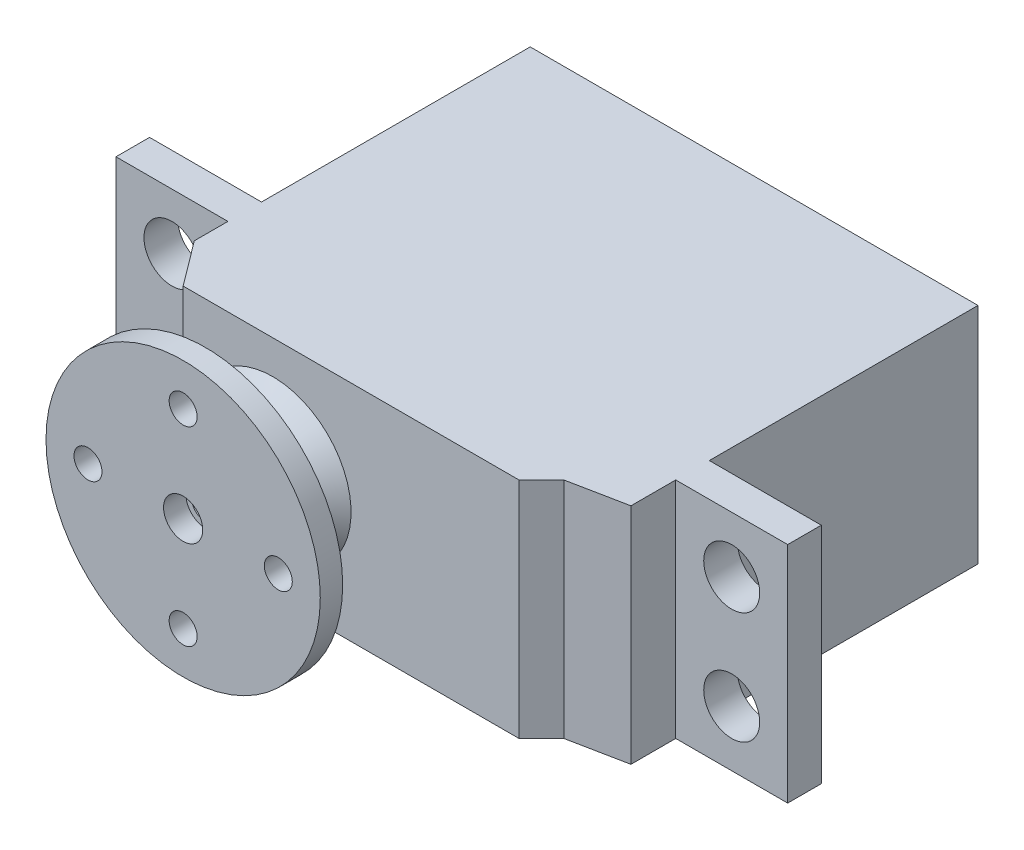
from build123d import *

# Parameters (mm, degrees)
SKETCH_1_W             = 40
SKETCH_1_H             = 20
EXTRUDE_1_DEPTH        = 37
CUT_EXTRUDE_1_DEPTH    = 47.572524089
CUT_EXTRUDE_2_DEPTH    = 47.572524089
CHAMFER_1_SIZE         = 3
SKETCH_4_R             = 7
EXTRUDE_2_DEPTH        = 2
CHAMFER_2_SIZE         = 2
SKETCH_5_R             = 3
EXTRUDE_3_DEPTH        = 4
SKETCH_6_W             = 10
SKETCH_6_H             = 20
EXTRUDE_4_DEPTH        = 3
SKETCH_7_R             = 2.5
CUT_EXTRUDE_3_DEPTH    = 3
HOLE_WIZARD_M3_1_D     = 2.5
HOLE_WIZARD_M3_1_DEPTH = 8.5
HOLE_WIZARD_M3_1_TIP   = 0.751075774
SKETCH_10_R            = 12.25
SKETCH_10_R_2          = 1.25
SKETCH_10_R_3          = 1.75
EXTRUDE_5_DEPTH        = 2


with BuildPart() as part:
    # 草图1 → 凸台-拉伸1 (new body)
    with BuildSketch(Plane.XY):
        Rectangle(SKETCH_1_W, SKETCH_1_H)
    extrude(amount=EXTRUDE_1_DEPTH)

    # 草图2 → 切除-拉伸1 (cut, through all)
    with BuildSketch(Plane.XZ.offset(10)):
        Polygon((20, 34), (15, 35), (13, 37), (20, 37), align=None)
    extrude(amount=-CUT_EXTRUDE_1_DEPTH, mode=Mode.SUBTRACT)

    # 草图3 → 切除-拉伸2 (cut, through all)
    with BuildSketch(Plane.XZ.offset(10)):
        Polygon((-20, 37), (-17, 37), (-20, 33), align=None)
    extrude(amount=-CUT_EXTRUDE_2_DEPTH, mode=Mode.SUBTRACT)

    # 倒角1
    chamfer_1_edges = [part.edges().sort_by_distance(p)[0] for p in [
        (0, -10, 0),
        (-20, 0, 0),
        (0, 10, 0),
        (20, 0, 0),
    ]]
    chamfer(chamfer_1_edges, length=CHAMFER_1_SIZE)

    # 草图4 → 凸台-拉伸2 (add)
    with BuildSketch(Plane.XY.offset(37)):
        with Locations(Location((-9, 0, 0), (0, 0, 180))):
            Circle(SKETCH_4_R)
    extrude(amount=EXTRUDE_2_DEPTH)

    # 倒角2
    chamfer_2_edges = [part.edges().sort_by_distance(p)[0] for p in [
        (-2, 0, 39),
    ]]
    chamfer(chamfer_2_edges, length=CHAMFER_2_SIZE - 0.0001)  # a hair under: the kernel refuses the full size

    # 草图5 → 凸台-拉伸3 (add)
    with BuildSketch(Plane.XY.offset(39)):
        with Locations((-9, 0)):
            Circle(SKETCH_5_R)
    extrude(amount=EXTRUDE_3_DEPTH)

    # 草图6 → 凸台-拉伸4 (add)
    with BuildSketch(Plane(origin=(0, 0, 30), x_dir=(-1, 0, 0), z_dir=(0, 0, -1))):
        with Locations((25, 0)):
            Rectangle(SKETCH_6_W, SKETCH_6_H)
        with Locations((-25, 0)):
            Rectangle(SKETCH_6_W, SKETCH_6_H)
    extrude(amount=EXTRUDE_4_DEPTH)

    # 草图7 → 切除-拉伸3 (cut)
    with BuildSketch(Plane.XY.offset(30)):
        with Locations((-25, 5)):
            Circle(SKETCH_7_R)
        with Locations((-25, -5)):
            Circle(SKETCH_7_R)
    cut_extrude_3 = extrude(amount=-CUT_EXTRUDE_3_DEPTH, mode=Mode.SUBTRACT)

    # 镜向1: 切除-拉伸3 across plane
    add(cut_extrude_3.mirror(Plane(origin=(0, 0, 0), x_dir=(0, 0, 1), z_dir=(1, 0, 0))), mode=Mode.SUBTRACT)

    # M3 螺纹孔1
    with Locations(Plane.XY.offset(43)):
        with Locations((-9, 0)):
            Hole(HOLE_WIZARD_M3_1_D / 2, depth=HOLE_WIZARD_M3_1_DEPTH)
            with Locations((0, 0, -(HOLE_WIZARD_M3_1_DEPTH + HOLE_WIZARD_M3_1_TIP / 2))):  # 118° drill point
                Cone(0, HOLE_WIZARD_M3_1_D / 2, HOLE_WIZARD_M3_1_TIP, mode=Mode.SUBTRACT)

    # 草图10 → 凸台-拉伸5 (add)
    with BuildSketch(Plane.XY.offset(43)):
        with Locations((-9, 0)):
            Circle(SKETCH_10_R)
        with Locations((-9, 8.5)):
            Circle(SKETCH_10_R_2, mode=Mode.SUBTRACT)
        with Locations((-0.5, 0)):
            Circle(SKETCH_10_R_2, mode=Mode.SUBTRACT)
        with Locations((-9, -8.5)):
            Circle(SKETCH_10_R_2, mode=Mode.SUBTRACT)
        with Locations((-17.5, 0)):
            Circle(SKETCH_10_R_2, mode=Mode.SUBTRACT)
        with Locations((-9, 0)):
            Circle(SKETCH_10_R_3, mode=Mode.SUBTRACT)
    extrude(amount=EXTRUDE_5_DEPTH)


solid = part.part
